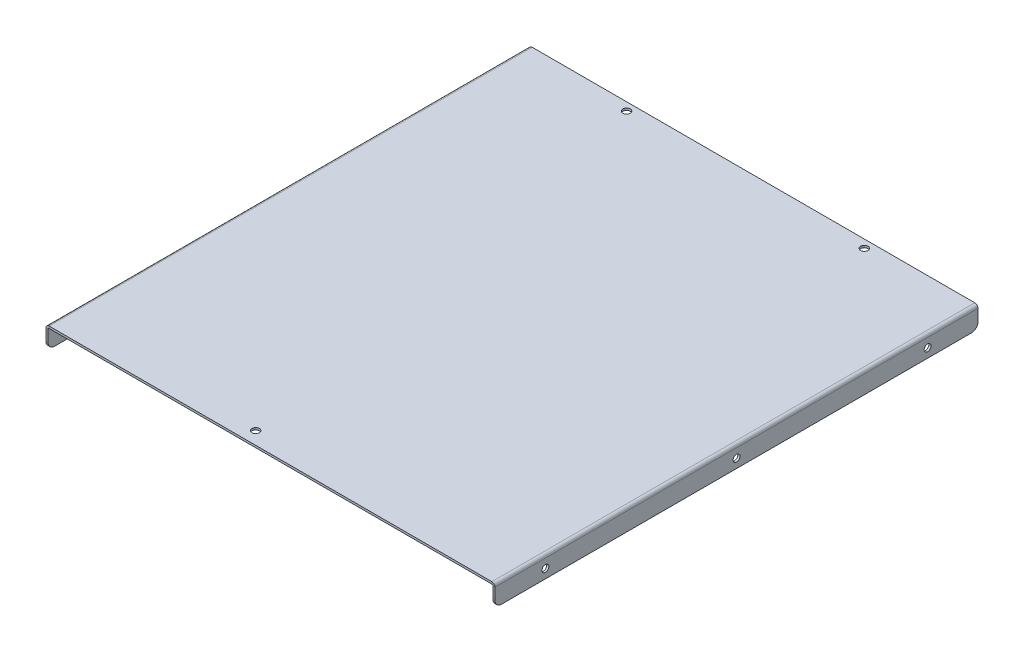
from build123d import *

# Parameters (mm, degrees)
SKETCH1_W                    = 211.5
SKETCH1_H                    = 227.5
BASE_FLANGE1_DEPTH           = 1
EDGE_FLANGE1_STRIP_W         = 5
EDGE_FLANGE1_STRIP_H         = 1
EDGE_FLANGE1_STRIP_CUT_DEPTH = 227.5
EDGE_FLANGE1_DEPTH           = 227.5
EDGE_FLANGE2_STRIP_W         = 5
EDGE_FLANGE2_STRIP_H         = 1
EDGE_FLANGE2_STRIP_CUT_DEPTH = 227.5
EDGE_FLANGE2_DEPTH           = 227.5
SKETCH13_R                   = 1.6
CUT_EXTRUDE1_DEPTH           = 241.356636064
FILLET1_R                    = 3
SKETCH14_R                   = 1.75
CUT_EXTRUDE2_DEPTH           = 156.634588058
SKETCH15_R                   = 1.75
CUT_EXTRUDE3_DEPTH           = 156.634588058


# Sheet-metal steps are written as plain solids
with BuildPart() as part:
    # Sketch1 → Base-Flange1 (new body)
    with BuildSketch(Plane(origin=(0, 0, 0), x_dir=(1, 0, 0), z_dir=(0, 1, 0))):
        Rectangle(SKETCH1_W, SKETCH1_H)
    extrude(amount=-BASE_FLANGE1_DEPTH)

    # Edge-Flange1 strip (across the edge) → Edge-Flange1 strip cut (cut)
    with BuildSketch(Plane(origin=(105.75, -1, -113.75), x_dir=(-1, 0, 0), z_dir=(0, 0, 1))):
        with Locations((-1, -0.5)):
            Rectangle(EDGE_FLANGE1_STRIP_W, EDGE_FLANGE1_STRIP_H)
    extrude(amount=EDGE_FLANGE1_STRIP_CUT_DEPTH, mode=Mode.SUBTRACT)

    # Edge-Flange1 section (across the edge) → Edge-Flange1 (add)
    with BuildSketch(Plane(origin=(105.75, -1, -113.75), x_dir=(-1, 0, 0), z_dir=(0, 0, 1))):
        with BuildLine():
            Line((0, 0.5), (0, 9))
            Line((0, 9), (1, 9))
            Line((1, 9), (1, 0.5))
            ThreePointArc((1, 0.5), (1.146446609, 0.146446609), (1.5, 0))
            Line((1.5, 0), (1.5, -1))
            ThreePointArc((1.5, -1), (0.439339828, -0.560660172), (0, 0.5))
        make_face()
    extrude(amount=EDGE_FLANGE1_DEPTH)

    # Edge-Flange2 strip (across the edge) → Edge-Flange2 strip cut (cut)
    with BuildSketch(Plane(origin=(-105.75, -1, 113.75), x_dir=(1, 0, 0), z_dir=(0, 0, -1))):
        with Locations((-1, -0.5)):
            Rectangle(EDGE_FLANGE2_STRIP_W, EDGE_FLANGE2_STRIP_H)
    extrude(amount=EDGE_FLANGE2_STRIP_CUT_DEPTH, mode=Mode.SUBTRACT)

    # Edge-Flange2 section (across the edge) → Edge-Flange2 (add)
    with BuildSketch(Plane(origin=(-105.75, -1, 113.75), x_dir=(1, 0, 0), z_dir=(0, 0, -1))):
        with BuildLine():
            Line((0, 0.5), (0, 9))
            Line((0, 9), (1, 9))
            Line((1, 9), (1, 0.5))
            ThreePointArc((1, 0.5), (1.146446609, 0.146446609), (1.5, 0))
            Line((1.5, 0), (1.5, -1))
            ThreePointArc((1.5, -1), (0.439339828, -0.560660172), (0, 0.5))
        make_face()
    extrude(amount=EDGE_FLANGE2_DEPTH)

    # Sketch13 → Cut-Extrude1 (cut, through all)
    with BuildSketch(Plane.ZY.offset(105.75)):
        with Locations(Location((0, -5.75, 0), (0, 0, 270))):
            Circle(SKETCH13_R)
        with Locations(Location((90, -5.75, 0), (0, 0, 270))):
            Circle(SKETCH13_R)
        with Locations(Location((-90, -5.75, 0), (0, 0, 270))):
            Circle(SKETCH13_R)
    extrude(amount=-CUT_EXTRUDE1_DEPTH, mode=Mode.SUBTRACT)

    # Fillet1
    fillet1_edges = [part.edges().sort_by_distance(p)[0] for p in [
        (105.25, -10, -113.75),
        (105.25, -10, 113.75),
        (-105.25, -10, 113.75),
        (-105.25, -10, -113.75),
    ]]
    fillet(fillet1_edges, radius=FILLET1_R)

    # Sketch14 → Cut-Extrude2 (cut, through all)
    with BuildSketch(Plane(origin=(0, 0, 0), x_dir=(1, 0, 0), z_dir=(0, 1, 0))):
        with Locations(Location((-56, 109.95, 0), (0, 0, 270))):
            Circle(SKETCH14_R)
        with Locations(Location((56, 109.95, 0), (0, 0, 270))):
            Circle(SKETCH14_R)
    extrude(amount=-CUT_EXTRUDE2_DEPTH, mode=Mode.SUBTRACT)

    # Sketch15 → Cut-Extrude3 (cut, through all)
    with BuildSketch(Plane(origin=(0, 0, 0), x_dir=(1, 0, 0), z_dir=(0, 1, 0))):
        with Locations(Location((-13, -107.75, 0), (0, 0, 270))):
            Circle(SKETCH15_R)
    extrude(amount=-CUT_EXTRUDE3_DEPTH, mode=Mode.SUBTRACT)


solid = part.part
